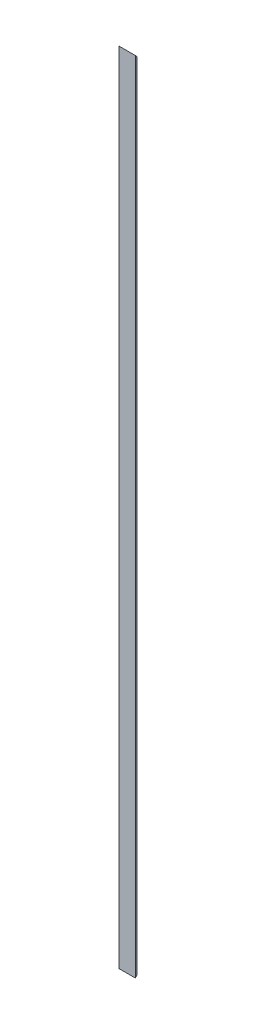
from build123d import *

# Parameters (mm, degrees)
EXTRUDE_1_DEPTH     = 2200
CUT_EXTRUDE_1_DEPTH = 2201.920262072


with BuildPart() as part:
    # Эскиз1 → Вытянуть-Тонкостенный1 (new body)
    with BuildSketch(Plane(origin=(0, 0, 0), x_dir=(1, 0, 0), z_dir=(0, 1, 0))):
        Polygon((0, 45), (0, 0), (45, 0), (45, 5), (5, 5), (5, 45), align=None)
    extrude(amount=EXTRUDE_1_DEPTH)

    # Эскиз2 → Вырез-Вытянуть1 (cut, through all)
    with BuildSketch(Plane.ZY):
        Polygon((0, 0), (-45, 45), (-45, 0), align=None)
        Polygon((-45, 2200), (0, 2200), (-45, 2155), align=None)
    extrude(amount=-CUT_EXTRUDE_1_DEPTH, mode=Mode.SUBTRACT)


solid = part.part
